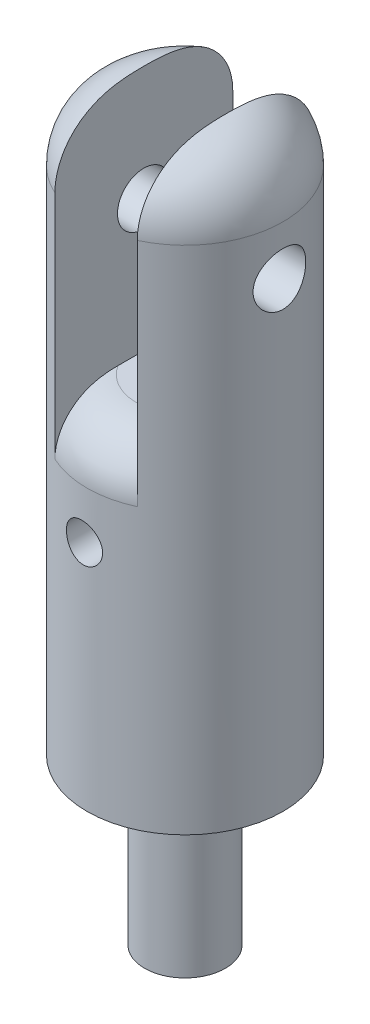
from build123d import *

# Parameters (mm, degrees)
SKETCH1_R               = 2.45
BOSS_EXTRUDE1_DEPTH     = 10
SKETCH2_R               = 5.95
BOSS_EXTRUDE2_DEPTH     = 35
SKETCH4_W               = 11.9
SKETCH4_H               = 15
CUT_EXTRUDE1_DEPTH      = 2.5
CUT_EXTRUDE2_DEPTH      = 46.779962866
CUT_EXTRUDE2_DEPTH_BACK = 46.779962866
SKETCH5_R               = 1.6
FILLET1_R               = 4
FILLET2_R               = 3
SKETCH6_R               = 1.15
CUT_EXTRUDE3_DEPTH      = 15


with BuildPart() as part:
    # Sketch1 → Boss-Extrude1 (new body)
    with BuildSketch(Plane(origin=(0, 0, 0), x_dir=(1, 0, 0), z_dir=(0, 1, 0))):
        with Locations(Location((0, 0, 0), (0, 0, 270))):
            Circle(SKETCH1_R)
    extrude(amount=BOSS_EXTRUDE1_DEPTH)

    # Sketch2 → Boss-Extrude2 (add)
    with BuildSketch(Plane(origin=(0, 10, 0), x_dir=(1, 0, 0), z_dir=(0, 1, 0))):
        with Locations(Location((0, 0, 0), (0, 0, 270))):
            Circle(SKETCH2_R)
    extrude(amount=BOSS_EXTRUDE2_DEPTH)

    # Sketch4 → Cut-Extrude1 (cut, symmetric)
    with BuildSketch(Plane(origin=(0, 0, 0), x_dir=(0, 0, -1), z_dir=(1, 0, 0))):
        with Locations((0, 37.5)):
            Rectangle(SKETCH4_W, SKETCH4_H)
    extrude(amount=CUT_EXTRUDE1_DEPTH, both=True, mode=Mode.SUBTRACT)

    # Sketch5 → Cut-Extrude2 (cut, two sides: drawn at the far end of the back side and taken through both)
    with BuildSketch(Plane(origin=(0, 0, 0), x_dir=(0, 0, -1), z_dir=(1, 0, 0)).offset(-CUT_EXTRUDE2_DEPTH_BACK)):
        with Locations((0, 38)):
            Circle(SKETCH5_R)
    extrude(amount=CUT_EXTRUDE2_DEPTH + CUT_EXTRUDE2_DEPTH_BACK, mode=Mode.SUBTRACT)

    # Fillet1
    # the kernel refuses this fillet: 4 mm, written as the material it takes off along each edge
    with BuildSketch(Plane(origin=(0, 45, 0), x_dir=(-0.9484971142590468, 0, 0.31678577026479715), z_dir=(-0.31678577026479715, 0, -0.9484971142590468))) as fillet1_piece_1:
        with BuildLine():
            CenterArc((5.95 - FILLET1_R, -FILLET1_R), FILLET1_R, 0, 90)
            Line((5.95 - FILLET1_R, 0), (5.95, 0))
            Line((5.95, 0), (5.95, -FILLET1_R))
        make_face()
    revolve(axis=Axis((0, 45, 0), (0, 1, 0)), revolution_arc=323.062694348, mode=Mode.SUBTRACT)
    with BuildSketch(Plane(origin=(0, 45, 0), x_dir=(0.948497114259044, 0, -0.31678577026480526), z_dir=(0.31678577026480526, 0, 0.948497114259044))) as fillet1_piece_2:
        with BuildLine():
            CenterArc((5.95 - FILLET1_R, -FILLET1_R), FILLET1_R, 0, 90)
            Line((5.95 - FILLET1_R, 0), (5.95, 0))
            Line((5.95, 0), (5.95, -FILLET1_R))
        make_face()
    revolve(axis=Axis((0, 45, 0), (0, 1, 0)), revolution_arc=323.062694348, mode=Mode.SUBTRACT)

    # Fillet2
    fillet2_edges = [part.edges().sort_by_distance(p)[0] for p in [
        (0, 30, -5.95),
        (1.279967228, 30, 5.810695646),
    ]]
    fillet(fillet2_edges, radius=FILLET2_R)

    # Sketch6 → Cut-Extrude3 (cut)
    with BuildSketch(Plane(origin=(-0.011753066, 0, 5.949988392), x_dir=(0.9999980490826653, 0, 0.0019753052582657496), z_dir=(-0.0019753052582657496, 0, 0.9999980490826653))):
        with Locations((-0.258432266, 24)):
            Circle(SKETCH6_R)
    extrude(amount=-CUT_EXTRUDE3_DEPTH, mode=Mode.SUBTRACT)


solid = part.part
